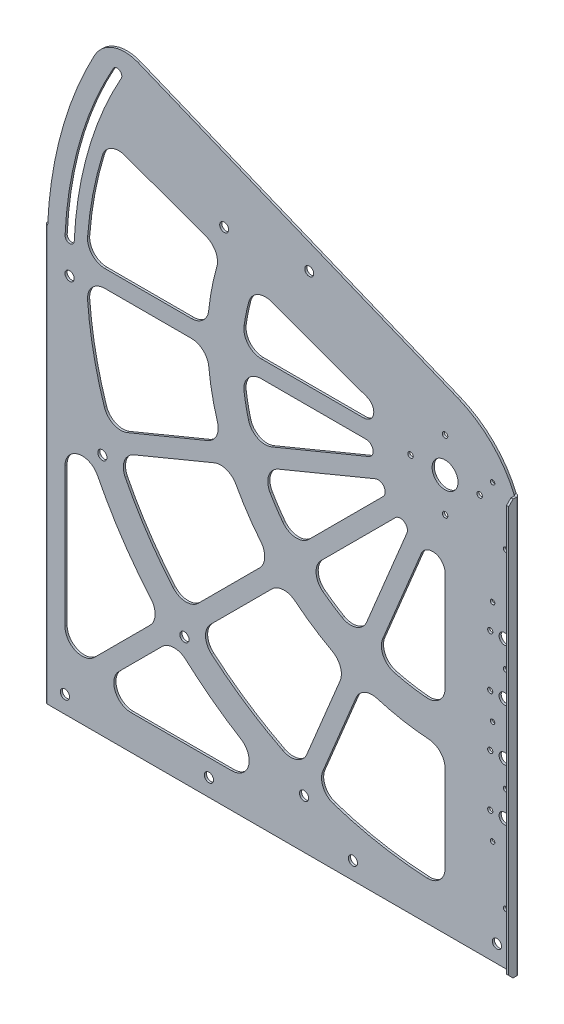
from build123d import *

# Parameters (mm, degrees)
SKETCH2_W           = 342.9
SKETCH2_H           = 457.2
BASE_FLANGE1_DEPTH  = 1.5875
CUT_EXTRUDE4_DEPTH  = 572.502204857
SKETCH11_R          = 3.3782
CUT_EXTRUDE2_DEPTH  = 572.502204857
CUT_EXTRUDE1_DEPTH  = 572.502204857
SKETCH12_R          = 3.3782
SKETCH12_R_2        = 1.651
CUT_EXTRUDE3_DEPTH  = 561.721310547
CUT_EXTRUDE7_DEPTH  = 561.721310547
SKETCH33_R          = 4
SKETCH33_R_2        = 1.905
CUT_EXTRUDE10_DEPTH = 561.721310547
EDGE_FLANGE1_DEPTH  = 304.8
EDGE_FLANGE2_DEPTH  = 304.8
BREAK_CORNER1_START = -2.3241
BREAK_CORNER1_DEPTH = 347.5482
CUT_EXTRUDE6_DEPTH  = 563.199378399
CUT_EXTRUDE8_DEPTH  = 563.199378399
SKETCH38_R          = 3.302
CUT_EXTRUDE12_DEPTH = 563.199378399


# Read off the part's stored shape, not the designer's step: Break-Corner1
# Sheet-metal steps are written as plain solids
with BuildPart() as part:
    # Sketch2 → Base-Flange1 (new body)
    with BuildSketch(Plane.XY):
        with Locations((171.45, 228.6)):
            Rectangle(SKETCH2_W, SKETCH2_H)
    extrude(amount=-BASE_FLANGE1_DEPTH)

    # Sketch13 → Cut-Extrude4 (cut, through all)
    with BuildSketch(Plane.XY):
        with BuildLine():
            ThreePointArc((48.171825547, 428.763803395), (23.257977777, 368.92393206), (12.792480929, 304.95531954))
            ThreePointArc((12.792480929, 304.95531954), (16.011788935, 301.425372453), (19.541736023, 304.64468046))
            ThreePointArc((19.541736023, 304.64468046), (29.754342049, 367.067539807), (54.066165518, 425.461425878))
            ThreePointArc((54.066165518, 425.461425878), (52.770184291, 430.059784622), (48.171825547, 428.763803395))
        make_face()
    extrude(amount=-CUT_EXTRUDE4_DEPTH, mode=Mode.SUBTRACT)

    # Sketch11 → Cut-Extrude2 (cut, through all)
    with BuildSketch(Plane.XY):
        with Locations((40.204262007, 178.747506397)):
            Circle(SKETCH11_R)
        with Locations((100.540612978, 93.0893172)):
            Circle(SKETCH11_R)
        with Locations((188.437827004, 36.064056205)):
            Circle(SKETCH11_R)
        with Locations((16.1097473, 280.714437242)):
            Circle(SKETCH11_R)
    extrude(amount=-CUT_EXTRUDE2_DEPTH, mode=Mode.SUBTRACT)

    # Sketch10 → Cut-Extrude1 (cut, through all)
    with BuildSketch(Plane.XY):
        with BuildLine():
            Line((-40.291044703, -621.894028175), (0, 304.8))
            ThreePointArc((0, 304.8), (10.145412323, 369.464788425), (34.422458536, 430.252034459))
            ThreePointArc((34.422458536, 430.252034459), (48.209724727, 442.150544976), (66.417211562, 441.762363709))
            Line((66.417211562, 441.762363709), (301.539322165, 345.67077664))
            ThreePointArc((301.539322165, 345.67077664), (326.271428246, 329.335722351), (342.9, 304.8))
            Line((342.9, 304.8), (704.017374327, -549.588337992))
            Line((704.017374327, -549.588337992), (524.644664306, 1296.858572009))
            Line((524.644664306, 1296.858572009), (-219.663754724, 1224.552881826))
            Line((-219.663754724, 1224.552881826), (-40.291044703, -621.894028175))
        make_face()
    extrude(amount=-CUT_EXTRUDE1_DEPTH, mode=Mode.SUBTRACT)

    # Sketch12 → Cut-Extrude3 (cut, through all)
    with BuildSketch(Plane.XY):
        with Locations((330.2, 12.7)):
            Circle(SKETCH12_R)
        with Locations((224.366666667, 12.7)):
            Circle(SKETCH12_R)
        with Locations((118.533333333, 12.7)):
            Circle(SKETCH12_R)
        with Locations((12.7, 12.7)):
            Circle(SKETCH12_R)
        with Locations((336.55, 38.1)):
            Circle(SKETCH12_R_2)
        with Locations((327.025, 76.2)):
            Circle(SKETCH12_R_2)
        with Locations((336.55, 114.3)):
            Circle(SKETCH12_R_2)
        with Locations((327.025, 152.4)):
            Circle(SKETCH12_R_2)
        with Locations((336.55, 190.5)):
            Circle(SKETCH12_R_2)
        with Locations((327.025, 228.6)):
            Circle(SKETCH12_R_2)
        with Locations((336.55, 266.7)):
            Circle(SKETCH12_R_2)
        with Locations((327.025, 304.8)):
            Circle(SKETCH12_R_2)
    extrude(amount=-CUT_EXTRUDE3_DEPTH, mode=Mode.SUBTRACT)

    # Sketch29 → Cut-Extrude7 (cut, through all)
    with BuildSketch(Plane.XY):
        with BuildLine():
            Line((12.7, 158.146603253), (12.7, 56.060512242))
            ThreePointArc((12.7, 56.060512242), (20.539920409, 44.327242179), (34.380256121, 47.080256121))
            Line((34.380256121, 47.080256121), (75.271534362, 87.971534362))
            ThreePointArc((75.271534362, 87.971534362), (78.982887179, 96.490203461), (75.900160018, 105.255969612))
            ThreePointArc((75.900160018, 105.255969612), (54.511524809, 133.339869751), (36.74893617, 163.846747796))
            ThreePointArc((36.74893617, 163.846747796), (22.470963415, 170.504222145), (12.7, 158.146603253))
        make_face()
        with BuildLine():
            Line((61.321024484, 25.4), (135.395173973, 25.4))
            ThreePointArc((135.395173973, 25.4), (147.613154271, 34.634317175), (142.063464443, 48.908510638))
            ThreePointArc((142.063464443, 48.908510638), (121.091555257, 63.169498916), (101.466712238, 79.233816455))
            ThreePointArc((101.466712238, 79.233816455), (92.644633062, 82.468287524), (84.01386555, 78.753353307))
            Line((84.01386555, 78.753353307), (52.340768363, 47.080256121))
            ThreePointArc((52.340768363, 47.080256121), (49.587754421, 33.239920409), (61.321024484, 25.4))
        make_face()
    extrude(amount=-CUT_EXTRUDE7_DEPTH, mode=Mode.SUBTRACT)

    # Sketch33 → Cut-Extrude10 (cut, through all)
    with BuildSketch(Plane.XY):
        with Locations((335.788, 95.25)):
            Circle(SKETCH33_R)
        with Locations((325.288, 95.25)):
            Circle(SKETCH33_R_2)
        with Locations((335.788, 133.35)):
            Circle(SKETCH33_R)
        with Locations((325.288, 133.35)):
            Circle(SKETCH33_R_2)
        with Locations((335.788, 171.45)):
            Circle(SKETCH33_R)
        with Locations((325.288, 171.45)):
            Circle(SKETCH33_R_2)
        with Locations((335.788, 209.55)):
            Circle(SKETCH33_R)
        with Locations((325.288, 209.55)):
            Circle(SKETCH33_R_2)
    extrude(amount=-CUT_EXTRUDE10_DEPTH, mode=Mode.SUBTRACT)

    # Edge-Flange1 section (across the edge) → Edge-Flange1 (add)
    with BuildSketch(Plane(origin=(-0.7366, 0, -1.5875), x_dir=(1, 0, 0), z_dir=(0, 1, 0))):
        with BuildLine():
            Line((-1.5875, 0.7366), (-1.5875, 6.35))
            Line((-1.5875, 6.35), (0, 6.35))
            Line((0, 6.35), (0, 0.7366))
            ThreePointArc((0, 0.7366), (0.215745145, 0.215745145), (0.7366, 0))
            Line((0.7366, 0), (0.7366, -1.5875))
            ThreePointArc((0.7366, -1.5875), (-0.90678687, -0.90678687), (-1.5875, 0.7366))
        make_face()
    extrude(amount=EDGE_FLANGE1_DEPTH)

    # Edge-Flange2 section (across the edge) → Edge-Flange2 (add)
    with BuildSketch(Plane(origin=(343.6366, 0, 0), x_dir=(-1, 0, 0), z_dir=(0, 1, 0))):
        with BuildLine():
            Line((-1.5875, 0.7366), (-1.5875, 6.35))
            Line((-1.5875, 6.35), (0, 6.35))
            Line((0, 6.35), (0, 0.7366))
            ThreePointArc((0, 0.7366), (0.215745145, 0.215745145), (0.7366, 0))
            Line((0.7366, 0), (0.7366, -1.5875))
            ThreePointArc((0.7366, -1.5875), (-0.90678687, -0.90678687), (-1.5875, 0.7366))
        make_face()
    extrude(amount=EDGE_FLANGE2_DEPTH)

    # Break-Corner1 outline → Break-Corner1 (cut)
    with BuildSketch(Plane.YZ.offset(BREAK_CORNER1_START)):
        Polygon((0, 6.35), (0, 3.175), (3.175, 6.35), align=None)
        Polygon((304.8, 6.35), (301.625, 6.35), (304.8, 3.175), align=None)
        Polygon((3.175, -7.9375), (0, -4.7625), (0, -7.9375), align=None)
        Polygon((304.8, -4.7625), (301.625, -7.9375), (304.8, -7.9375), align=None)
    extrude(amount=BREAK_CORNER1_DEPTH, mode=Mode.SUBTRACT)

    # Sketch27 → Cut-Extrude6 (cut, through all)
    with BuildSketch(Plane(origin=(0, 0, -1.5875), x_dir=(-1, 0, 0), z_dir=(0, 0, -1))):
        with BuildLine():
            ThreePointArc((-292.1, 268.7193), (-294.1193, 266.7), (-292.1, 264.6807))
            ThreePointArc((-292.1, 264.6807), (-290.0807, 266.7), (-292.1, 268.7193))
        make_face()
        with BuildLine():
            ThreePointArc((-317.5, 294.1193), (-319.5193, 292.1), (-317.5, 290.0807))
            ThreePointArc((-317.5, 290.0807), (-315.4807, 292.1), (-317.5, 294.1193))
        make_face()
        with BuildLine():
            ThreePointArc((-266.7, 294.1193), (-268.7193, 292.1), (-266.7, 290.0807))
            ThreePointArc((-266.7, 290.0807), (-264.6807, 292.1), (-266.7, 294.1193))
        make_face()
        with BuildLine():
            ThreePointArc((-292.1, 319.5193), (-294.1193, 317.5), (-292.1, 315.4807))
            ThreePointArc((-292.1, 315.4807), (-290.0807, 317.5), (-292.1, 319.5193))
        make_face()
        with BuildLine():
            ThreePointArc((-292.1, 282.575), (-282.575, 292.1), (-292.1, 301.625))
            ThreePointArc((-292.1, 301.625), (-301.625, 292.1), (-292.1, 282.575))
        make_face()
    extrude(amount=-CUT_EXTRUDE6_DEPTH, mode=Mode.SUBTRACT)

    # Sketch31 → Cut-Extrude8 (cut, through all)
    with BuildSketch(Plane.XY):
        with BuildLine():
            Line((232.2196036, 298.45), (156.910602764, 298.45))
            ThreePointArc((156.910602764, 298.45), (147.324269226, 302.819801365), (144.334844882, 312.922093023))
            ThreePointArc((144.334844882, 312.922093023), (145.789091178, 321.446525938), (147.734679118, 329.87240728))
            ThreePointArc((147.734679118, 329.87240728), (154.123723646, 337.905448625), (164.364745226, 338.591830604))
            Line((164.364745226, 338.591830604), (234.77868179, 312.963253617))
            ThreePointArc((234.77868179, 312.963253617), (239.588175574, 304.632966026), (232.2196036, 298.45))
        make_face()
        with BuildLine():
            Line((41.999463965, 285.75), (105.746161496, 285.75))
            ThreePointArc((105.746161496, 285.75), (114.257554659, 282.475825504), (118.380320039, 274.341525424))
            ThreePointArc((118.380320039, 274.341525424), (120.83037041, 258.032352518), (124.808069285, 242.027047793))
            ThreePointArc((124.808069285, 242.027047793), (124.111992608, 232.93422043), (117.501463006, 226.652108479))
            Line((117.501463006, 226.652108479), (58.607193892, 202.257303465))
            ThreePointArc((58.607193892, 202.257303465), (48.444656047, 202.450472295), (41.678613759, 210.035665859))
            ThreePointArc((41.678613759, 210.035665859), (33.638558982, 240.688822891), (29.336145685, 272.085443038))
            ThreePointArc((29.336145685, 272.085443038), (32.684425763, 281.682500408), (41.999463965, 285.75))
        make_face()
        with BuildLine():
            Line((236.056094186, 275.759044595), (164.771243086, 246.231892478))
            ThreePointArc((164.771243086, 246.231892478), (154.242375153, 246.600531498), (147.614527541, 254.789828824))
            ThreePointArc((147.614527541, 254.789828824), (145.742316532, 262.987646697), (144.334844882, 271.277906977))
            ThreePointArc((144.334844882, 271.277906977), (147.324269226, 281.380198635), (156.910602764, 285.75))
            Line((156.910602764, 285.75), (234.068769594, 285.75))
            ThreePointArc((234.068769594, 285.75), (239.16211449, 281.569999869), (236.056094186, 275.759044595))
        make_face()
        with BuildLine():
            Line((240.916173777, 264.025774532), (169.631322677, 234.498622415))
            ThreePointArc((169.631322677, 234.498622415), (162.446955914, 226.792921351), (163.551067595, 216.315617687))
            ThreePointArc((163.551067595, 216.315617687), (168.023947104, 209.195031978), (172.890813618, 202.337699968))
            ThreePointArc((172.890813618, 202.337699968), (182.148054781, 197.308143257), (192.016532409, 200.996788531))
            Line((192.016532409, 200.996788531), (246.575595399, 255.55585152))
            ThreePointArc((246.575595399, 255.55585152), (247.221427676, 262.113096673), (240.916173777, 264.025774532))
        make_face()
        with BuildLine():
            Line((255.55585152, 246.575595399), (200.996788531, 192.016532409))
            ThreePointArc((200.996788531, 192.016532409), (197.308143257, 182.148054781), (202.337699968, 172.890813618))
            ThreePointArc((202.337699968, 172.890813618), (209.195031978, 168.023947104), (216.315617687, 163.551067595))
            ThreePointArc((216.315617687, 163.551067595), (226.792921351, 162.446955914), (234.498622415, 169.631322677))
            Line((234.498622415, 169.631322677), (264.025774532, 240.916173777))
            ThreePointArc((264.025774532, 240.916173777), (262.113096673, 247.221427676), (255.55585152, 246.575595399))
        make_face()
        with BuildLine():
            Line((274.558972166, 233.158863052), (246.231892478, 164.771243086))
            ThreePointArc((246.231892478, 164.771243086), (246.600531498, 154.242375153), (254.789828824, 147.614527541))
            ThreePointArc((254.789828824, 147.614527541), (266.422554338, 145.100784324), (278.218604651, 143.522049118))
            ThreePointArc((278.218604651, 143.522049118), (287.952376251, 146.778325163), (292.1, 156.166981108))
            Line((292.1, 156.166981108), (292.1, 229.669735679))
            ThreePointArc((292.1, 229.669735679), (284.7612125, 238.612074122), (274.558972166, 233.158863052))
        make_face()
        with BuildLine():
            Line((56.703921301, 377.777165909), (116.477091381, 356.021511193))
            ThreePointArc((116.477091381, 356.021511193), (123.454876342, 349.841976459), (124.334558573, 340.562844406))
            ThreePointArc((124.334558573, 340.562844406), (120.668638768, 325.344232749), (118.380320039, 309.858474576))
            ThreePointArc((118.380320039, 309.858474576), (114.257554659, 301.724174496), (105.746161496, 298.45))
            Line((105.746161496, 298.45), (41.999463965, 298.45))
            ThreePointArc((41.999463965, 298.45), (32.684425763, 302.517499592), (29.336145685, 312.114556962))
            ThreePointArc((29.336145685, 312.114556962), (33.179825429, 341.148637343), (40.221544746, 369.576895935))
            ThreePointArc((40.221544746, 369.576895935), (46.703246286, 377.213563627), (56.703921301, 377.777165909))
        make_face()
        with BuildLine():
            Line((122.361542597, 214.918838416), (63.467273483, 190.524033402))
            ThreePointArc((63.467273483, 190.524033402), (56.417865048, 183.201442989), (56.99709247, 173.0535868))
            ThreePointArc((56.99709247, 173.0535868), (72.986970418, 145.693354344), (92.145467813, 120.450325713))
            ThreePointArc((92.145467813, 120.450325713), (101.299203707, 116.031772916), (110.762086931, 119.742343052))
            Line((110.762086931, 119.742343052), (155.837809033, 164.818065155))
            ThreePointArc((155.837809033, 164.818065155), (159.541081867, 173.151719965), (156.704498478, 181.81877407))
            ThreePointArc((156.704498478, 181.81877407), (146.904618952, 195.083548059), (138.399817294, 209.213665414))
            ThreePointArc((138.399817294, 209.213665414), (131.478016867, 215.151064763), (122.361542597, 214.918838416))
        make_face()
        with BuildLine():
            Line((164.818065155, 155.837809033), (119.742343052, 110.762086931))
            ThreePointArc((119.742343052, 110.762086931), (116.031772916, 101.299203707), (120.450325713, 92.145467813))
            ThreePointArc((120.450325713, 92.145467813), (145.693354344, 72.986970418), (173.0535868, 56.99709247))
            ThreePointArc((173.0535868, 56.99709247), (183.201442989, 56.417865048), (190.524033402, 63.467273483))
            Line((190.524033402, 63.467273483), (214.918838416, 122.361542597))
            ThreePointArc((214.918838416, 122.361542597), (215.151064763, 131.478016867), (209.213665414, 138.399817294))
            ThreePointArc((209.213665414, 138.399817294), (195.083548059, 146.904618952), (181.81877407, 156.704498478))
            ThreePointArc((181.81877407, 156.704498478), (173.151719965, 159.541081867), (164.818065155, 155.837809033))
        make_face()
        with BuildLine():
            Line((226.652108479, 117.501463006), (202.257303465, 58.607193892))
            ThreePointArc((202.257303465, 58.607193892), (202.450472295, 48.444656047), (210.035665859, 41.678613759))
            ThreePointArc((210.035665859, 41.678613759), (243.971195838, 33.007267885), (278.756962025, 28.91301521))
            ThreePointArc((278.756962025, 28.91301521), (288.149954792, 32.39192814), (292.1, 41.596725321))
            Line((292.1, 41.596725321), (292.1, 105.20600431))
            ThreePointArc((292.1, 105.20600431), (288.679679824, 113.876502702), (280.261016949, 117.876783679))
            ThreePointArc((280.261016949, 117.876783679), (260.950640265, 120.275647788), (242.027047793, 124.808069285))
            ThreePointArc((242.027047793, 124.808069285), (232.93422043, 124.111992608), (226.652108479, 117.501463006))
        make_face()
    extrude(amount=-CUT_EXTRUDE8_DEPTH, mode=Mode.SUBTRACT)

    # Sketch38 → Cut-Extrude12 (cut, through all)
    with BuildSketch(Plane.XY):
        with Locations((192.263910318, 371.808759735)):
            Circle(SKETCH38_R)
        with Locations((129.742063011, 368.549362038)):
            Circle(SKETCH38_R)
    extrude(amount=-CUT_EXTRUDE12_DEPTH, mode=Mode.SUBTRACT)


solid = part.part
